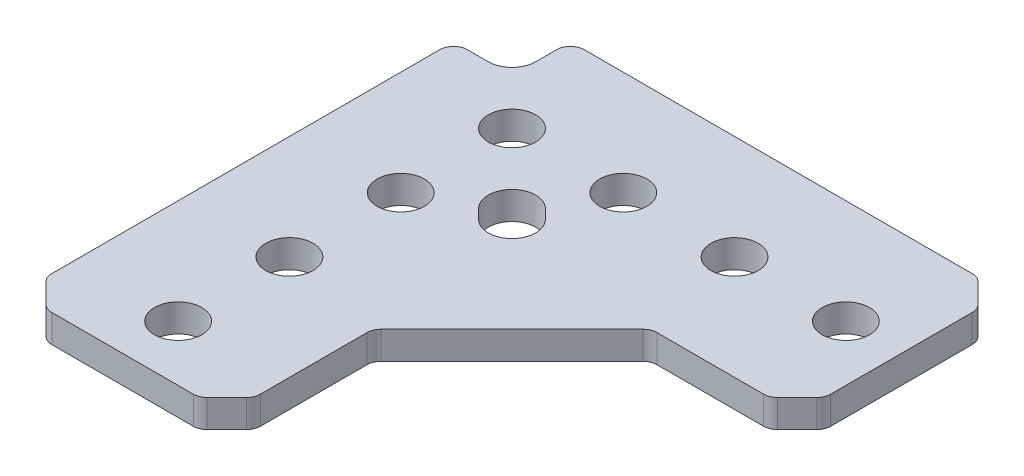
from build123d import *

# Parameters (mm, degrees)
SKETCH1_R           = 1.7
BOSS_EXTRUDE1_DEPTH = 2


with BuildPart() as part:
    # Sketch1 → Boss-Extrude1 (new body)
    with BuildSketch(Plane(origin=(0, 2, 0), x_dir=(1, 0, 0), z_dir=(0, 1, 0))):
        with BuildLine():
            Line((26.292893219, -7.207106781), (27.707106781, -5.792893219))
            ThreePointArc((27.707106781, -5.792893219), (27.923879533, -5.46846987), (28, -5.085786438))
            Line((28, -5.085786438), (28, 5.085786438))
            ThreePointArc((28, 5.085786438), (27.923879533, 5.46846987), (27.707106781, 5.792893219))
            Line((27.707106781, 5.792893219), (26.292893219, 7.207106781))
            ThreePointArc((26.292893219, 7.207106781), (25.96846987, 7.423879533), (25.585786438, 7.5))
            Line((25.585786438, 7.5), (-2.3, 7.5))
            ThreePointArc((-2.3, 7.5), (-3.007106781, 7.207106781), (-3.3, 6.5))
            Line((-3.3, 6.5), (-3.3, 5))
            ThreePointArc((-3.3, 5), (-3.797918472, 3.797918472), (-5, 3.3))
            Line((-5, 3.3), (-6.5, 3.3))
            ThreePointArc((-6.5, 3.3), (-7.207106781, 3.007106781), (-7.5, 2.3))
            Line((-7.5, 2.3), (-7.5, -25.585786438))
            ThreePointArc((-7.5, -25.585786438), (-7.423879533, -25.96846987), (-7.207106781, -26.292893219))
            Line((-7.207106781, -26.292893219), (-5.792893219, -27.707106781))
            ThreePointArc((-5.792893219, -27.707106781), (-5.46846987, -27.923879533), (-5.085786438, -28))
            Line((-5.085786438, -28), (5.085786438, -28))
            ThreePointArc((5.085786438, -28), (5.46846987, -27.923879533), (5.792893219, -27.707106781))
            Line((5.792893219, -27.707106781), (7.207106781, -26.292893219))
            ThreePointArc((7.207106781, -26.292893219), (7.423879533, -25.96846987), (7.5, -25.585786438))
            Line((7.5, -25.585786438), (7.5, -17.914213562))
            ThreePointArc((7.5, -17.914213562), (7.576120467, -17.53153013), (7.792893219, -17.207106781))
            Line((7.792893219, -17.207106781), (17.207106781, -7.792893219))
            ThreePointArc((17.207106781, -7.792893219), (17.53153013, -7.576120467), (17.914213562, -7.5))
            Line((17.914213562, -7.5), (25.585786438, -7.5))
            ThreePointArc((25.585786438, -7.5), (25.96846987, -7.423879533), (26.292893219, -7.207106781))
        make_face()
        with Locations((0, -16)):
            Circle(SKETCH1_R, mode=Mode.SUBTRACT)
        with Locations((0, -24)):
            Circle(SKETCH1_R, mode=Mode.SUBTRACT)
        with Locations((24, 0)):
            Circle(SKETCH1_R, mode=Mode.SUBTRACT)
        with Locations((16, 0)):
            Circle(SKETCH1_R, mode=Mode.SUBTRACT)
        Circle(SKETCH1_R, mode=Mode.SUBTRACT)
        with Locations((8, 0)):
            Circle(SKETCH1_R, mode=Mode.SUBTRACT)
        with Locations((0, -8)):
            Circle(SKETCH1_R, mode=Mode.SUBTRACT)
        with BuildLine():
            Line((4.454772721, -6.858935778), (3.797918472, -6.202081528))
            ThreePointArc((3.797918472, -6.202081528), (3.797918472, -3.797918472), (6.202081528, -3.797918472))
            Line((6.202081528, -3.797918472), (6.858935778, -4.454772721))
            ThreePointArc((6.858935778, -4.454772721), (6.858935778, -6.858935778), (4.454772721, -6.858935778))
        make_face(mode=Mode.SUBTRACT)
    extrude(amount=-BOSS_EXTRUDE1_DEPTH)


solid = part.part
